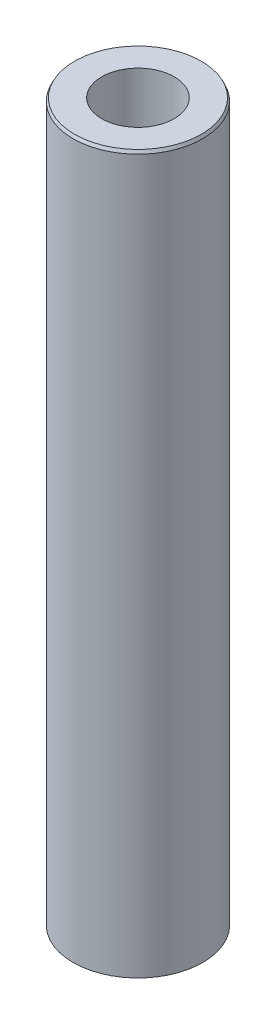
from build123d import *
from OCP.BRepFilletAPI import BRepFilletAPI_MakeChamfer

# Parameters (mm, degrees)
SKETCH1_R           = 37.5
BOSS_EXTRUDE1_DEPTH = 415.226512019
SKETCH2_R           = 20.994594314
CUT_EXTRUDE1_DEPTH  = 419.599517777
CHAMFER1_SIZE       = 1.784367697
CHAMFER1_SIZE2      = 0.858408219


with BuildPart() as part:
    # Sketch1 → Boss-Extrude1 (new body)
    with BuildSketch(Plane(origin=(0, 0, 0), x_dir=(1, 0, 0), z_dir=(0, 1, 0))):
        Circle(SKETCH1_R)
    extrude(amount=BOSS_EXTRUDE1_DEPTH)

    # Sketch2 → Cut-Extrude1 (cut, through all)
    with BuildSketch(Plane(origin=(0, 0, 0), x_dir=(1, 0, 0), z_dir=(0, 1, 0))):
        Circle(SKETCH2_R)
    extrude(amount=CUT_EXTRUDE1_DEPTH, mode=Mode.SUBTRACT)

    # Chamfer1: one chamfer whose edges measure the first distance from different faces: ONE call of the kernel's chamfer builder (chamfer() names one face for all edges)
    chamfer1_edges_1 = [part.edges().sort_by_distance(p)[0] for p in [
        (-37.5, 415.226512019, 0),
    ]]
    chamfer1_side_1 = [part.faces().sort_by_distance(p)[0] for p in [
        (-37.5, 207.613256009, 0),
    ]]
    chamfer1_edges_2 = [part.edges().sort_by_distance(p)[0] for p in [
        (-37.5, 0, 0),
    ]]
    chamfer1_side_2 = [part.faces().sort_by_distance(p)[0] for p in [
        (-36.439339828, 0, 0),
    ]]
    chamfer1 = BRepFilletAPI_MakeChamfer(part.part.solid().wrapped)
    for e in chamfer1_edges_1:
        chamfer1.Add(CHAMFER1_SIZE, CHAMFER1_SIZE2, e.wrapped, chamfer1_side_1[0].wrapped)  # the first distance lies on this face
    for e in chamfer1_edges_2:
        chamfer1.Add(CHAMFER1_SIZE, CHAMFER1_SIZE2, e.wrapped, chamfer1_side_2[0].wrapped)  # the first distance lies on this face
    add(Compound.cast(chamfer1.Shape()), mode=Mode.REPLACE)


solid = part.part
